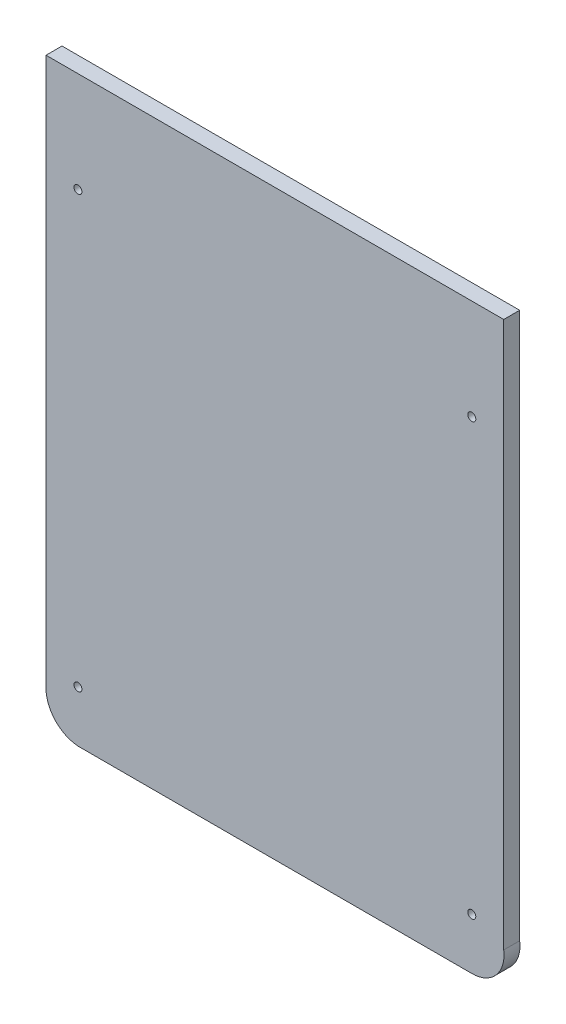
from build123d import *

# Parameters (mm, degrees)
BOSS_EXTRUDE1_DEPTH = 6.35
HOLE1_D             = 3.175
HOLE1_DEPTH         = 31.75
HOLE1_CSINK_D       = 10.16
HOLE1_CSINK_ANGLE   = 82
HOLE1_TIP           = 0.953866233


with BuildPart() as part:
    # Sketch1 → Boss-Extrude1 (new body)
    with BuildSketch(Plane.XY):
        with BuildLine():
            Line((-19.05, 920.17470301), (163.099999994, 920.17470301))
            Line((163.099999994, 920.17470301), (163.099999994, 702.843692969))
            ThreePointArc((163.099999994, 702.843692969), (160.057961653, 692.7131448), (150.399999994, 688.39970301))
            Line((150.399999994, 688.39970301), (-6.35, 688.39970301))
            ThreePointArc((-6.35, 688.39970301), (-15.057025907, 692.392677103), (-19.05, 701.09970301))
            Line((-19.05, 701.09970301), (-19.05, 920.17470301))
        make_face()
    extrude(amount=BOSS_EXTRUDE1_DEPTH)

    # Hole1
    with Locations(Plane(origin=(72.024999997, -412.792793272, 19.05), x_dir=(1, 0, 0), z_dir=(0, 0, 1))):
        with Locations((-78.374999997, 1293.039195846), (-78.374999997, 1121.589195846), (78.374999997, 1121.589195846), (78.374999997, 1293.039195846), (-764.015524801, 1530.078195669)):
            CounterSinkHole(HOLE1_D / 2, HOLE1_CSINK_D / 2, depth=HOLE1_DEPTH, counter_sink_angle=HOLE1_CSINK_ANGLE)
            with Locations((0, 0, -(HOLE1_DEPTH + HOLE1_TIP / 2))):  # 118° drill point
                Cone(0, HOLE1_D / 2, HOLE1_TIP, mode=Mode.SUBTRACT)


solid = part.part
